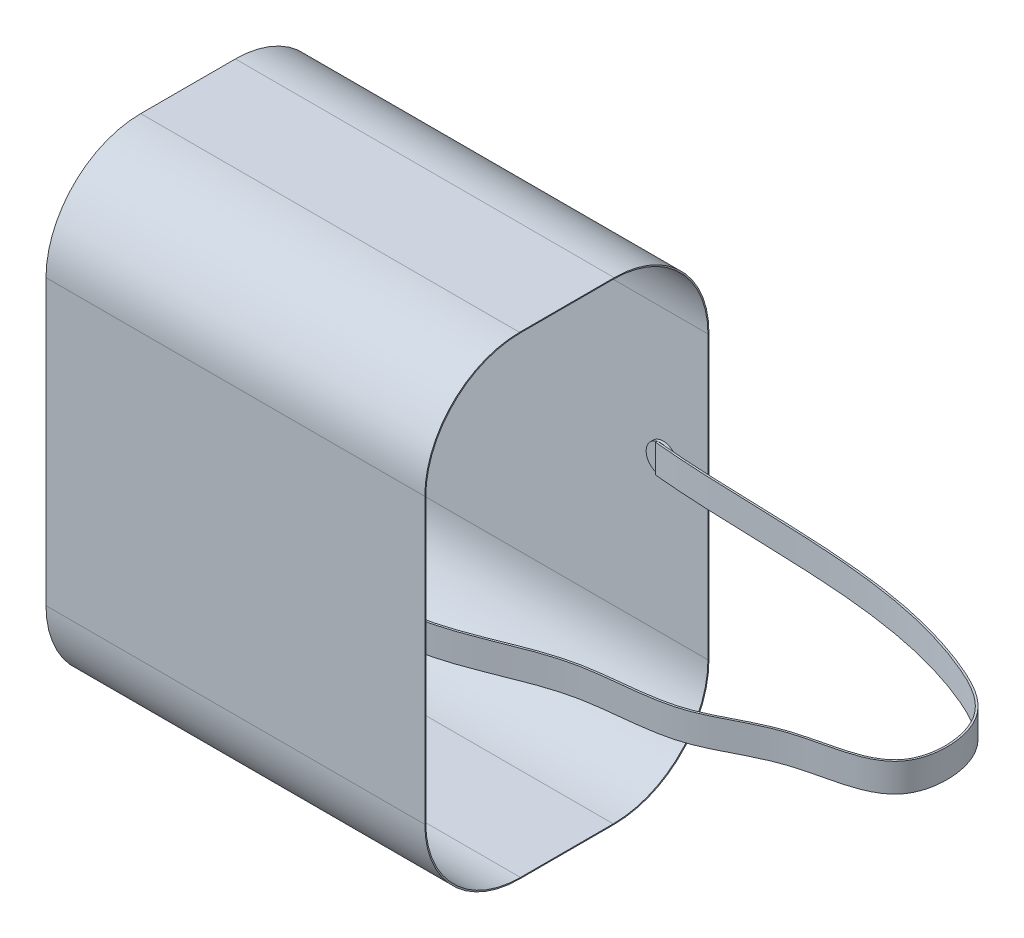
from build123d import *

# Parameters (mm, degrees)
SKETCH_1_W          = 400
SKETCH_1_H          = 500
EXTRUDE_1_DEPTH     = 300
SKETCH_2_W          = 298
SKETCH_2_H          = 498
CUT_EXTRUDE_1_DEPTH = 399
FILLET_3_R          = 100
FILLET_5_R          = 100
SKETCH_3_R          = 15
EXTRUDE_2_DEPTH     = 3
SWEEP_START         = -2.594942292
SWEEP_1_DEPTH       = 30


# Read off the part's stored shape, not the designer's step: 扫描1
with BuildPart() as part:
    # 草图1 → 凸台-拉伸1 (new body)
    with BuildSketch(Plane.XY):
        Rectangle(SKETCH_1_W, SKETCH_1_H)
    extrude(amount=EXTRUDE_1_DEPTH)

    # 草图2 → 切除-拉伸1 (cut)
    with BuildSketch(Plane(origin=(200, 0, 0), x_dir=(0, 0, -1), z_dir=(1, 0, 0))):
        with Locations((-150, 0)):
            Rectangle(SKETCH_2_W, SKETCH_2_H)
    extrude(amount=-CUT_EXTRUDE_1_DEPTH, mode=Mode.SUBTRACT)

    # 圆角3
    fillet_3_edges = [part.edges().sort_by_distance(p)[0] for p in [
        (0.5, -249, 1),
        (0.5, -249, 299),
        (0.5, 249, 299),
        (0.5, 249, 1),
    ]]
    fillet(fillet_3_edges, radius=FILLET_3_R)

    # 圆角5
    fillet_5_edges = [part.edges().sort_by_distance(p)[0] for p in [
        (0, -250, 300),
        (0, -250, 0),
        (0, 250, 0),
        (0, 250, 300),
    ]]
    fillet(fillet_5_edges, radius=FILLET_5_R)

    # 草图3 → 凸台-拉伸2 (add)
    with BuildSketch(Plane(origin=(0, 0, 299), x_dir=(-1, 0, 0), z_dir=(0, 0, -1))):
        with Locations(Location((-152.737273025, 12.405057708, 0), (0, 0, 180))):
            Circle(SKETCH_3_R)
    extrude_2 = extrude(amount=EXTRUDE_2_DEPTH)

    # 镜向1: 凸台-拉伸2 across plane
    add(extrude_2.mirror(Plane.XY.offset(150)))

    # 扫描1 outline → 扫描1 (add)
    with BuildSketch(Plane(origin=(0, 0, 0), x_dir=(1, 0, 0), z_dir=(0, 1, 0)).offset(SWEEP_START)):
        with BuildLine():
            Line((152.737273025, -294), (152.737273025, -296))
            add(Edge.make_bspline(
                [(152.737273025, -296), (181.935493993, -296.511701017), (207.946620925, -288.418760625), (258.508037988, -269.14801764), (283.067300137, -257.973224025), (325.76888261, -248.577164167), (342.928032471, -247.040385771), (376.878518776, -243.18819179), (393.672356066, -240.873230474), (422.074519338, -231.416917995), (433.978363896, -225.288911151), (458.305178686, -212.908086097), (470.727891929, -206.653862092), (500.483609135, -196.844179869), (518.432498046, -193.843961433), (542.537778684, -186.67014408), (550.107301045, -183.830806692), (563.353734606, -176.186546891), (569.03395138, -171.371724945), (579.550358513, -155.527417003), (582.428003107, -142.7370063), (582.037497044, -116.451025377), (578.763367569, -102.94191571), (566.807102056, -81.534812389), (558.443513707, -73.462245395), (539.219743003, -60.255524495), (528.354478429, -55.111053663), (458.253117474, -25.603790186), (397.418296378, -16.995747895), (274.331428309, -9.237497333), (212.070402504, -10.082824989), (149.955692167, -4.11819507)],
                knots=[0, 0, 0, 0, 0.085170448, 0.085170448, 0.170340896, 0.170340896, 0.223415799, 0.223415799, 0.276490703, 0.276490703, 0.319654038, 0.319654038, 0.362817374, 0.362817374, 0.412908351, 0.412908351, 0.43795384, 0.43795384, 0.462999328, 0.462999328, 0.500788204, 0.500788204, 0.53857708, 0.53857708, 0.574410027, 0.574410027, 0.610242974, 0.610242974, 0.805121487, 0.805121487, 1, 1, 1, 1], degree=3))
            Line((149.955692167, -4.11819507), (149.799709155, -6.112103117))
            add(Edge.make_bspline(
                [(152.737273025, -294), (181.531087289, -294.511454246), (207.279702321, -286.531350756), (257.684767107, -267.323374803), (282.332244272, -256.092495021), (325.473201637, -246.591553833), (342.699340386, -245.053245298), (376.586268696, -241.209399931), (393.244557401, -238.903408832), (421.216774291, -229.598655459), (433.034982053, -223.525374419), (457.371647162, -211.139315338), (469.890361495, -204.827943088), (500.030018073, -194.884082743), (517.999583767, -191.88314448), (541.848196732, -184.790641165), (549.276007522, -181.997107394), (562.125839823, -174.590997945), (567.544555762, -169.988321803), (577.569856631, -154.912317887), (580.418945746, -142.48885977), (580.048639028, -116.828294482), (576.835222023, -103.604726756), (565.267100154, -82.865082891), (557.157252805, -75.009353782), (538.298967806, -62.044430446), (527.555612378, -56.945553148), (457.811657456, -27.581380303), (397.224715408, -18.989024358), (274.343787595, -11.240113598), (212.05878071, -12.08802288), (149.799709155, -6.112103117)],
                knots=[0, 0, 0, 0, 0.085170448, 0.085170448, 0.170340896, 0.170340896, 0.223415799, 0.223415799, 0.276490703, 0.276490703, 0.319654038, 0.319654038, 0.362817374, 0.362817374, 0.412908351, 0.412908351, 0.43795384, 0.43795384, 0.462999328, 0.462999328, 0.500788204, 0.500788204, 0.53857708, 0.53857708, 0.574410027, 0.574410027, 0.610242974, 0.610242974, 0.805121487, 0.805121487, 1, 1, 1, 1], degree=3))
        make_face()
    extrude(amount=SWEEP_1_DEPTH)


solid = part.part
